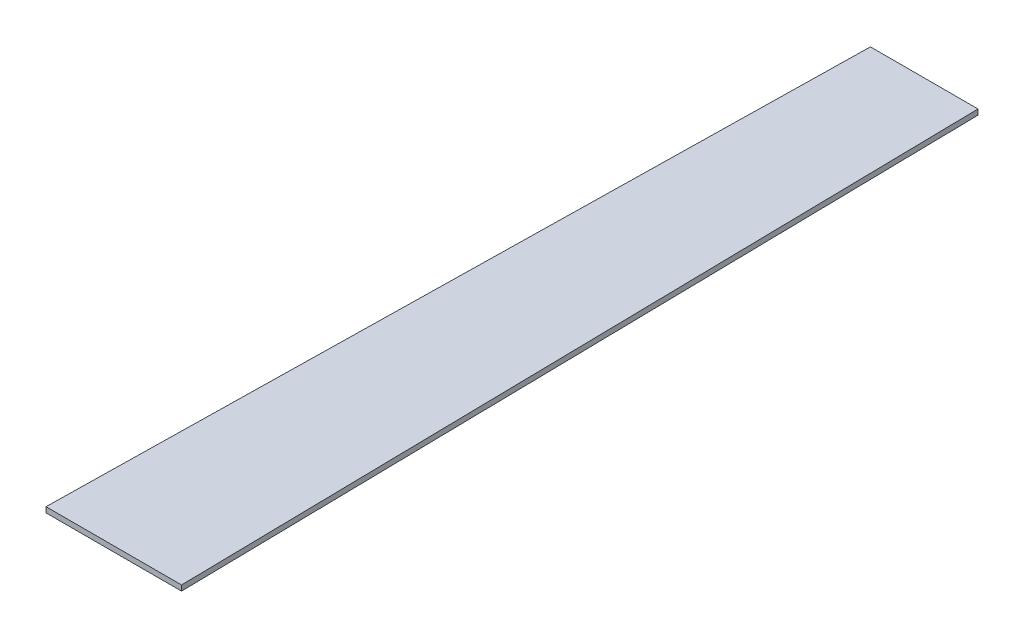
from build123d import *

# Parameters (mm, degrees)
BOSS_EXTRUDE1_DEPTH = 100


with BuildPart() as part:
    # Sketch1 → Boss-Extrude1 (new body)
    with BuildSketch(Plane(origin=(0, 0, 0), x_dir=(1, 0, 0), z_dir=(0, 1, 0))):
        Polygon((0, 0), (2000, 0), (2260, -15067.75696645), (-260, -15067.75696645), align=None)
    extrude(amount=BOSS_EXTRUDE1_DEPTH)


solid = part.part
